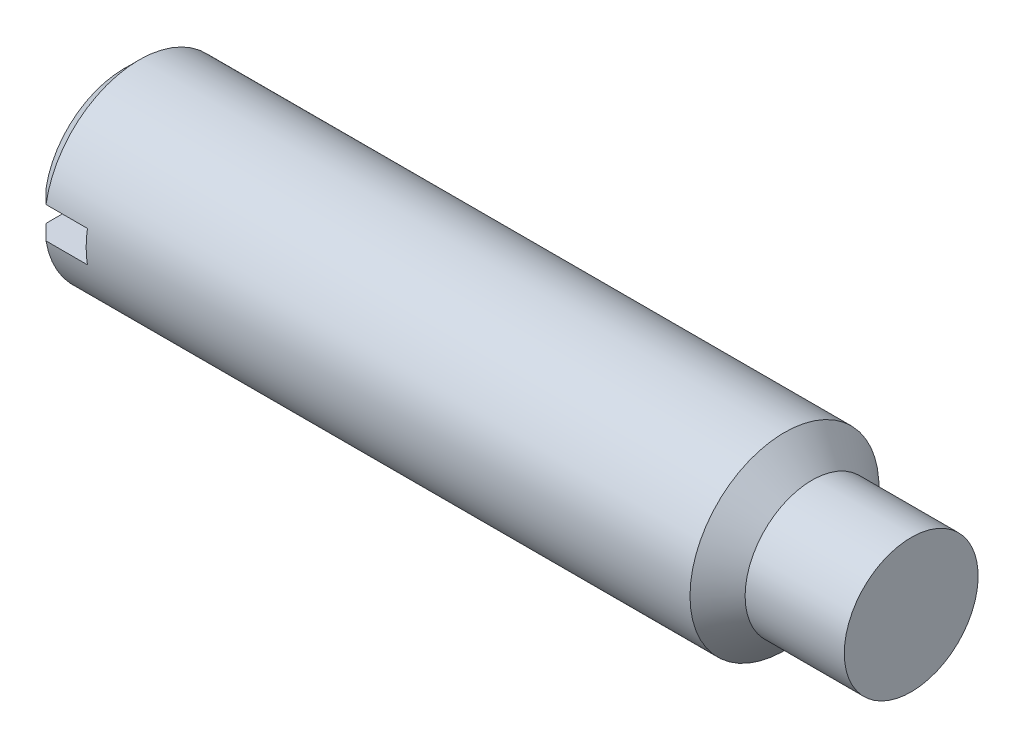
from build123d import *

# Parameters (mm, degrees)
SLOTSKE_W  = 12
SLOTSKE_H  = 2
SLOT_DEPTH = 3.6


with BuildPart() as part:
    # BodySke → BaseBody (revolve)
    with BuildSketch(Plane.XY):
        Polygon((0, 0), (0, 5.036), (0.964, 6), (41.95, 6), (43.7, 4.25), (50, 4.25), (50, 0), align=None)
    revolve(axis=Axis((0, 0, 0), (1, 0, 0)))

    # SlotSke → Slot (cut)
    with BuildSketch(Plane(origin=(0, 0, 0), x_dir=(0, 0, -1), z_dir=(1, 0, 0))):
        Rectangle(SLOTSKE_W, SLOTSKE_H)
    extrude(amount=SLOT_DEPTH, mode=Mode.SUBTRACT)


solid = part.part
